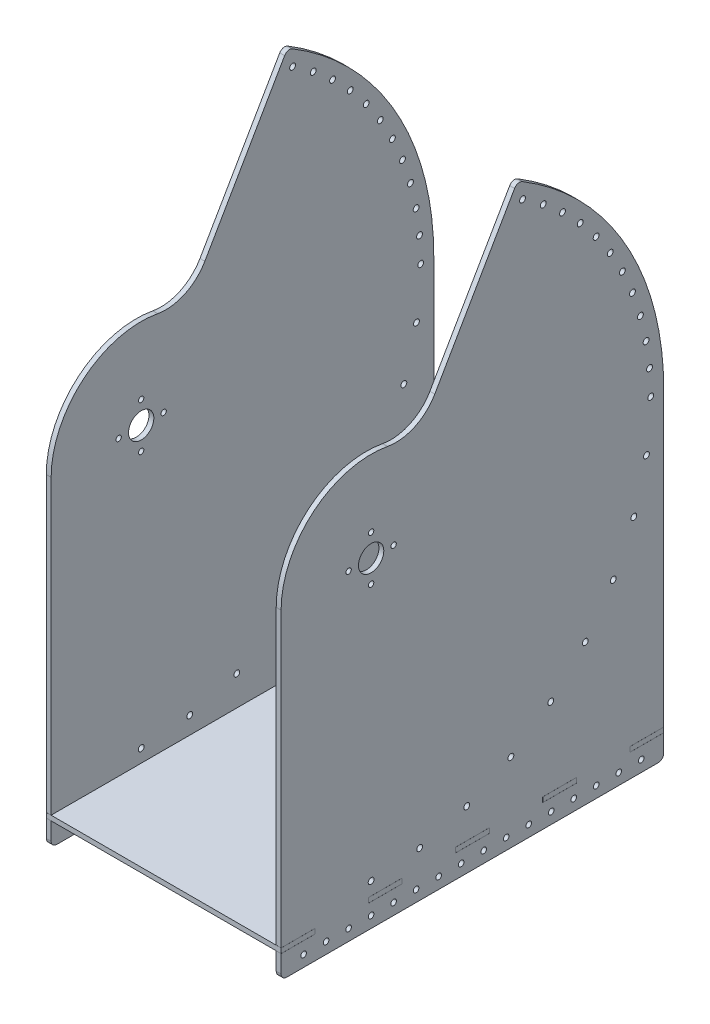
from build123d import *

# Parameters (mm, degrees)
SKETCH1_R                      = 3.302
BOSS_EXTRUDE1_DEPTH            = 2.75
CUT_EXTRUDE1_DEPTH             = 468.005706603
CUT_EXTRUDE1_DEPTH_BACK        = 468.005706603
SKETCH2_R                      = 14.2875
SKETCH2_R_2                    = 3
SKETCH3_W                      = 431.8
SKETCH3_H                      = 31.75
SKETCH3_R                      = 3.175
BOSS_EXTRUDE2_DEPTH            = 5.5
SKETCH4_W                      = 431.8
SKETCH4_H                      = 5.5
BOSS_EXTRUDE3_DEPTH            = 254
BOSS_EXTRUDE4_START            = 256.75
SKETCH1_4_R                    = 3.302
BOSS_EXTRUDE4_DEPTH            = 5.5
BOSS_EXTRUDE5_START            = 254
SKETCH3_2_W                    = 431.8
SKETCH3_2_H                    = 31.75
SKETCH3_2_R                    = 3.175
BOSS_EXTRUDE5_DEPTH            = 5.5
CUT_EXTRUDE2_DEPTH             = 301.418697827
CUT_EXTRUDE2_DEPTH_BACK        = 555.418697827
CUT_EXTRUDE2_START             = 254
SKETCH2_2_R                    = 14.2875
SKETCH2_2_R_2                  = 3
FILLET2_R                      = 6.35
FILLET3_R                      = 50.8
FILLET4_R                      = 50.8
FILLET5_R                      = 6.35
TAB_START                      = 256.75
TAB_AND_SLOT_TAB1_OUTLINE_W    = 5.5
TAB_AND_SLOT_TAB1_OUTLINE_H    = 38.1
TAB_AND_SLOT_TAB1_DEPTH        = 5.5
TAB_START_2                    = -335.75
TAB_AND_SLOT_SLOT1_OUTLINE_W   = 5.5
TAB_AND_SLOT_SLOT1_OUTLINE_H   = 38.15
TAB_AND_SLOT_SLOT1_OUTLINE_H_2 = 38.2
TAB_AND_SLOT_SLOT1_DEPTH       = 5.6
TAB_START_3                    = -330.2
TAB_AND_SLOT_TAB2_OUTLINE_W    = 5.5
TAB_AND_SLOT_TAB2_OUTLINE_H    = 5.5
TAB_AND_SLOT_TAB2_DEPTH        = 38.1
TAB_START_4                    = -231.775
TAB_AND_SLOT_TAB2_2_OUTLINE_W  = 5.5
TAB_AND_SLOT_TAB2_2_OUTLINE_H  = 5.5
TAB_AND_SLOT_TAB2_2_DEPTH      = 38.1
TAB_START_5                    = -133.35
TAB_AND_SLOT_TAB2_3_OUTLINE_W  = 5.5
TAB_AND_SLOT_TAB2_3_OUTLINE_H  = 5.5
TAB_AND_SLOT_TAB2_3_DEPTH      = 38.1
TAB_START_6                    = -34.925
TAB_AND_SLOT_TAB2_4_OUTLINE_W  = 5.5
TAB_AND_SLOT_TAB2_4_OUTLINE_H  = 5.5
TAB_AND_SLOT_TAB2_4_DEPTH      = 38.1
TAB_START_7                    = 63.5
TAB_AND_SLOT_TAB2_5_OUTLINE_W  = 5.5
TAB_AND_SLOT_TAB2_5_OUTLINE_H  = 5.5
TAB_AND_SLOT_TAB2_5_DEPTH      = 38.1
TAB_AND_SLOT_SLOT2_OUTLINE_W   = 5.5
TAB_AND_SLOT_SLOT2_OUTLINE_H   = 38.15
TAB_AND_SLOT_SLOT2_OUTLINE_H_2 = 38.2
TAB_AND_SLOT_SLOT2_DEPTH       = 5.6


# Read off the part's stored shape, not the designer's step: Tab and Slot-Tab1, Tab and Slot-Slot1, Tab and Slot-Tab2, Tab and Slot-Slot2
with BuildPart() as part:
    # Sketch1 → Boss-Extrude1 (new, symmetric)
    with BuildSketch(Plane(origin=(0, 0, 0), x_dir=(0, 0, -1), z_dir=(1, 0, 0))):
        with BuildLine():
            Line((330.2, 0), (330.2, -330.2))
            Line((330.2, -330.2), (0, -330.2))
            Line((0, -330.2), (-101.6, -330.2))
            Line((-101.6, -330.2), (-101.6, 0))
            ThreePointArc((-101.6, 0), (-50.8, 87.988181024), (50.8, 87.988181024))
            Line((50.8, 87.988181024), (165.1, 285.96158833))
            ThreePointArc((165.1, 285.96158833), (285.96158833, 165.1), (330.2, 0))
        make_face()
        with Locations((315.468, 0)):
            Circle(SKETCH1_R, mode=Mode.SUBTRACT)
        with Locations((314.169659463, 28.59167881)):
            Circle(SKETCH1_R, mode=Mode.SUBTRACT)
        with Locations((310.285324755, 56.948013714)):
            Circle(SKETCH1_R, mode=Mode.SUBTRACT)
        with Locations((303.846968623, 84.83559797)):
            Circle(SKETCH1_R, mode=Mode.SUBTRACT)
        with Locations((294.907586481, 112.024883217)):
            Circle(SKETCH1_R, mode=Mode.SUBTRACT)
        with Locations((283.540760198, 138.292068935)):
            Circle(SKETCH1_R, mode=Mode.SUBTRACT)
        with Locations((269.840052424, 163.420944593)):
            Circle(SKETCH1_R, mode=Mode.SUBTRACT)
        with Locations((253.918236464, 187.204669319)):
            Circle(SKETCH1_R, mode=Mode.SUBTRACT)
        with Locations((235.906368013, 209.447474453)):
            Circle(SKETCH1_R, mode=Mode.SUBTRACT)
        with Locations((215.952706413, 229.966274955)):
            Circle(SKETCH1_R, mode=Mode.SUBTRACT)
        with Locations((194.221494298, 248.592176419)):
            Circle(SKETCH1_R, mode=Mode.SUBTRACT)
        with Locations((170.891605681, 265.171865272)):
            Circle(SKETCH1_R, mode=Mode.SUBTRACT)
        with Locations((310.675332227, -54.780443312)):
            Circle(SKETCH1_R, mode=Mode.SUBTRACT)
        with Locations((296.442951694, -107.896410575)):
            Circle(SKETCH1_R, mode=Mode.SUBTRACT)
        with Locations((273.203302081, -157.734)):
            Circle(SKETCH1_R, mode=Mode.SUBTRACT)
        with Locations((241.662508382, -202.778921653)):
            Circle(SKETCH1_R, mode=Mode.SUBTRACT)
        with Locations((202.778921653, -241.662508382)):
            Circle(SKETCH1_R, mode=Mode.SUBTRACT)
        with Locations((157.734, -273.203302081)):
            Circle(SKETCH1_R, mode=Mode.SUBTRACT)
        with Locations((107.896410575, -296.442951694)):
            Circle(SKETCH1_R, mode=Mode.SUBTRACT)
        with Locations((54.780443312, -310.675332227)):
            Circle(SKETCH1_R, mode=Mode.SUBTRACT)
        with Locations((0, -315.468)):
            Circle(SKETCH1_R, mode=Mode.SUBTRACT)
    extrude(amount=BOSS_EXTRUDE1_DEPTH, both=True)

    # Sketch2 → Cut-Extrude1 (cut, two sides: drawn at the far end of the back side and taken through both)
    with BuildSketch(Plane(origin=(2.75, 0, 0), x_dir=(0, 0, -1), z_dir=(1, 0, 0)).offset(-CUT_EXTRUDE1_DEPTH_BACK)):
        Circle(SKETCH2_R)
        with Locations((0, 25.4)):
            Circle(SKETCH2_R_2)
        with Locations((25.4, 0)):
            Circle(SKETCH2_R_2)
        with Locations((0, -25.4)):
            Circle(SKETCH2_R_2)
        with Locations((-25.4, 0)):
            Circle(SKETCH2_R_2)
    extrude(amount=CUT_EXTRUDE1_DEPTH + CUT_EXTRUDE1_DEPTH_BACK, mode=Mode.SUBTRACT)

    # Sketch3 → Boss-Extrude2 (add)
    with BuildSketch(Plane(origin=(2.75, 0, 0), x_dir=(0, 0, -1), z_dir=(1, 0, 0))):
        with Locations((114.3, -346.075)):
            Rectangle(SKETCH3_W, SKETCH3_H)
        with Locations((-76.2, -349.25)):
            Circle(SKETCH3_R, mode=Mode.SUBTRACT)
        with Locations((-50.8, -349.25)):
            Circle(SKETCH3_R, mode=Mode.SUBTRACT)
        with Locations((-25.4, -349.25)):
            Circle(SKETCH3_R, mode=Mode.SUBTRACT)
        with Locations((0, -349.25)):
            Circle(SKETCH3_R, mode=Mode.SUBTRACT)
        with Locations((25.4, -349.25)):
            Circle(SKETCH3_R, mode=Mode.SUBTRACT)
        with Locations((50.8, -349.25)):
            Circle(SKETCH3_R, mode=Mode.SUBTRACT)
        with Locations((76.2, -349.25)):
            Circle(SKETCH3_R, mode=Mode.SUBTRACT)
        with Locations((101.6, -349.25)):
            Circle(SKETCH3_R, mode=Mode.SUBTRACT)
        with Locations((127, -349.25)):
            Circle(SKETCH3_R, mode=Mode.SUBTRACT)
        with Locations((152.4, -349.25)):
            Circle(SKETCH3_R, mode=Mode.SUBTRACT)
        with Locations((177.8, -349.25)):
            Circle(SKETCH3_R, mode=Mode.SUBTRACT)
        with Locations((203.2, -349.25)):
            Circle(SKETCH3_R, mode=Mode.SUBTRACT)
        with Locations((228.6, -349.25)):
            Circle(SKETCH3_R, mode=Mode.SUBTRACT)
        with Locations((254, -349.25)):
            Circle(SKETCH3_R, mode=Mode.SUBTRACT)
        with Locations((279.4, -349.25)):
            Circle(SKETCH3_R, mode=Mode.SUBTRACT)
        with Locations((304.8, -349.25)):
            Circle(SKETCH3_R, mode=Mode.SUBTRACT)
    extrude(amount=-BOSS_EXTRUDE2_DEPTH)

    # Fillet4
    fillet4_edges = [part.edges().sort_by_distance(p)[0] for p in [
        (0, 87.988181024, -50.8),
    ]]
    fillet(fillet4_edges, radius=FILLET4_R)

    # Fillet5
    fillet5_edges = [part.edges().sort_by_distance(p)[0] for p in [
        (0, -361.95, -330.2),
        (0, -361.95, 101.6),
        (0, 285.96158833, -165.1),
    ]]
    fillet(fillet5_edges, radius=FILLET5_R)

    # Tab and Slot-Slot2 outline → Tab and Slot-Slot2 (cut)
    with BuildSketch(Plane(origin=(0, 0, 0), x_dir=(1, 0, 0), z_dir=(0, 1, 0)).offset(TAB_START_2)):
        with Locations((0, -82.525)):
            Rectangle(TAB_AND_SLOT_SLOT2_OUTLINE_W, TAB_AND_SLOT_SLOT2_OUTLINE_H)
        with Locations((0, 15.875)):
            Rectangle(TAB_AND_SLOT_SLOT2_OUTLINE_W, TAB_AND_SLOT_SLOT2_OUTLINE_H_2)
        with Locations((0, 114.3)):
            Rectangle(TAB_AND_SLOT_SLOT2_OUTLINE_W, TAB_AND_SLOT_SLOT2_OUTLINE_H_2)
        with Locations((0, 212.725)):
            Rectangle(TAB_AND_SLOT_SLOT2_OUTLINE_W, TAB_AND_SLOT_SLOT2_OUTLINE_H_2)
        with Locations((0, 311.125)):
            Rectangle(TAB_AND_SLOT_SLOT2_OUTLINE_W, TAB_AND_SLOT_SLOT2_OUTLINE_H)
    extrude(amount=TAB_AND_SLOT_SLOT2_DEPTH, mode=Mode.SUBTRACT)


with BuildPart() as body_2:
    # Sketch4 → Boss-Extrude3 (new body)
    with BuildSketch(Plane(origin=(2.75, 0, 0), x_dir=(0, 0, -1), z_dir=(1, 0, 0))):
        with Locations((114.3, -332.95)):
            Rectangle(SKETCH4_W, SKETCH4_H)
    extrude(amount=BOSS_EXTRUDE3_DEPTH)

    # Tab and Slot-Tab1 outline → Tab and Slot-Tab1 (add)
    with BuildSketch(Plane.YZ.offset(TAB_START)):
        with Locations((-332.95, 82.55)):
            Rectangle(TAB_AND_SLOT_TAB1_OUTLINE_W, TAB_AND_SLOT_TAB1_OUTLINE_H)
        with Locations((-332.95, -15.875)):
            Rectangle(TAB_AND_SLOT_TAB1_OUTLINE_W, TAB_AND_SLOT_TAB1_OUTLINE_H)
        with Locations((-332.95, -114.3)):
            Rectangle(TAB_AND_SLOT_TAB1_OUTLINE_W, TAB_AND_SLOT_TAB1_OUTLINE_H)
        with Locations((-332.95, -212.725)):
            Rectangle(TAB_AND_SLOT_TAB1_OUTLINE_W, TAB_AND_SLOT_TAB1_OUTLINE_H)
        with Locations((-332.95, -311.15)):
            Rectangle(TAB_AND_SLOT_TAB1_OUTLINE_W, TAB_AND_SLOT_TAB1_OUTLINE_H)
    extrude(amount=TAB_AND_SLOT_TAB1_DEPTH)

    # Tab and Slot-Tab2 outline → Tab and Slot-Tab2 (add)
    with BuildSketch(Plane.XY.offset(TAB_START_3)):
        with Locations((0, -332.95)):
            Rectangle(TAB_AND_SLOT_TAB2_OUTLINE_W, TAB_AND_SLOT_TAB2_OUTLINE_H)
    extrude(amount=TAB_AND_SLOT_TAB2_DEPTH)

    # Tab and Slot-Tab2 2 outline → Tab and Slot-Tab2 2 (add)
    with BuildSketch(Plane.XY.offset(TAB_START_4)):
        with Locations((0, -332.95)):
            Rectangle(TAB_AND_SLOT_TAB2_2_OUTLINE_W, TAB_AND_SLOT_TAB2_2_OUTLINE_H)
    extrude(amount=TAB_AND_SLOT_TAB2_2_DEPTH)

    # Tab and Slot-Tab2 3 outline → Tab and Slot-Tab2 3 (add)
    with BuildSketch(Plane.XY.offset(TAB_START_5)):
        with Locations((0, -332.95)):
            Rectangle(TAB_AND_SLOT_TAB2_3_OUTLINE_W, TAB_AND_SLOT_TAB2_3_OUTLINE_H)
    extrude(amount=TAB_AND_SLOT_TAB2_3_DEPTH)

    # Tab and Slot-Tab2 4 outline → Tab and Slot-Tab2 4 (add)
    with BuildSketch(Plane.XY.offset(TAB_START_6)):
        with Locations((0, -332.95)):
            Rectangle(TAB_AND_SLOT_TAB2_4_OUTLINE_W, TAB_AND_SLOT_TAB2_4_OUTLINE_H)
    extrude(amount=TAB_AND_SLOT_TAB2_4_DEPTH)

    # Tab and Slot-Tab2 5 outline → Tab and Slot-Tab2 5 (add)
    with BuildSketch(Plane.XY.offset(TAB_START_7)):
        with Locations((0, -332.95)):
            Rectangle(TAB_AND_SLOT_TAB2_5_OUTLINE_W, TAB_AND_SLOT_TAB2_5_OUTLINE_H)
    extrude(amount=TAB_AND_SLOT_TAB2_5_DEPTH)


with BuildPart() as body_3:
    # Sketch1<4> → Boss-Extrude4 (new body)
    with BuildSketch(Plane(origin=(0, 0, 0), x_dir=(0, 0, -1), z_dir=(1, 0, 0)).offset(BOSS_EXTRUDE4_START)):
        with BuildLine():
            Line((330.2, 0), (330.2, -330.2))
            Line((330.2, -330.2), (0, -330.2))
            Line((0, -330.2), (-101.6, -330.2))
            Line((-101.6, -330.2), (-101.6, 0))
            ThreePointArc((-101.6, 0), (-50.8, 87.988181024), (50.8, 87.988181024))
            Line((50.8, 87.988181024), (165.1, 285.96158833))
            ThreePointArc((165.1, 285.96158833), (285.96158833, 165.1), (330.2, 0))
        make_face()
        with Locations((315.468, 0)):
            Circle(SKETCH1_4_R, mode=Mode.SUBTRACT)
        with Locations((314.169659463, 28.59167881)):
            Circle(SKETCH1_4_R, mode=Mode.SUBTRACT)
        with Locations((310.285324755, 56.948013714)):
            Circle(SKETCH1_4_R, mode=Mode.SUBTRACT)
        with Locations((303.846968623, 84.83559797)):
            Circle(SKETCH1_4_R, mode=Mode.SUBTRACT)
        with Locations((294.907586481, 112.024883217)):
            Circle(SKETCH1_4_R, mode=Mode.SUBTRACT)
        with Locations((283.540760198, 138.292068935)):
            Circle(SKETCH1_4_R, mode=Mode.SUBTRACT)
        with Locations((269.840052424, 163.420944593)):
            Circle(SKETCH1_4_R, mode=Mode.SUBTRACT)
        with Locations((253.918236464, 187.204669319)):
            Circle(SKETCH1_4_R, mode=Mode.SUBTRACT)
        with Locations((235.906368013, 209.447474453)):
            Circle(SKETCH1_4_R, mode=Mode.SUBTRACT)
        with Locations((215.952706413, 229.966274955)):
            Circle(SKETCH1_4_R, mode=Mode.SUBTRACT)
        with Locations((194.221494298, 248.592176419)):
            Circle(SKETCH1_4_R, mode=Mode.SUBTRACT)
        with Locations((170.891605681, 265.171865272)):
            Circle(SKETCH1_4_R, mode=Mode.SUBTRACT)
        with Locations((310.675332227, -54.780443312)):
            Circle(SKETCH1_4_R, mode=Mode.SUBTRACT)
        with Locations((296.442951694, -107.896410575)):
            Circle(SKETCH1_4_R, mode=Mode.SUBTRACT)
        with Locations((273.203302081, -157.734)):
            Circle(SKETCH1_4_R, mode=Mode.SUBTRACT)
        with Locations((241.662508382, -202.778921653)):
            Circle(SKETCH1_4_R, mode=Mode.SUBTRACT)
        with Locations((202.778921653, -241.662508382)):
            Circle(SKETCH1_4_R, mode=Mode.SUBTRACT)
        with Locations((157.734, -273.203302081)):
            Circle(SKETCH1_4_R, mode=Mode.SUBTRACT)
        with Locations((107.896410575, -296.442951694)):
            Circle(SKETCH1_4_R, mode=Mode.SUBTRACT)
        with Locations((54.780443312, -310.675332227)):
            Circle(SKETCH1_4_R, mode=Mode.SUBTRACT)
        with Locations((0, -315.468)):
            Circle(SKETCH1_4_R, mode=Mode.SUBTRACT)
    extrude(amount=BOSS_EXTRUDE4_DEPTH)


with BuildPart() as body_4:
    # Sketch3<2> → Boss-Extrude5 (new body)
    with BuildSketch(Plane(origin=(2.75, 0, 0), x_dir=(0, 0, -1), z_dir=(1, 0, 0)).offset(BOSS_EXTRUDE5_START)):
        with Locations((114.3, -346.075)):
            Rectangle(SKETCH3_2_W, SKETCH3_2_H)
        with Locations((-76.2, -349.25)):
            Circle(SKETCH3_2_R, mode=Mode.SUBTRACT)
        with Locations((-50.8, -349.25)):
            Circle(SKETCH3_2_R, mode=Mode.SUBTRACT)
        with Locations((-25.4, -349.25)):
            Circle(SKETCH3_2_R, mode=Mode.SUBTRACT)
        with Locations((0, -349.25)):
            Circle(SKETCH3_2_R, mode=Mode.SUBTRACT)
        with Locations((25.4, -349.25)):
            Circle(SKETCH3_2_R, mode=Mode.SUBTRACT)
        with Locations((50.8, -349.25)):
            Circle(SKETCH3_2_R, mode=Mode.SUBTRACT)
        with Locations((76.2, -349.25)):
            Circle(SKETCH3_2_R, mode=Mode.SUBTRACT)
        with Locations((101.6, -349.25)):
            Circle(SKETCH3_2_R, mode=Mode.SUBTRACT)
        with Locations((127, -349.25)):
            Circle(SKETCH3_2_R, mode=Mode.SUBTRACT)
        with Locations((152.4, -349.25)):
            Circle(SKETCH3_2_R, mode=Mode.SUBTRACT)
        with Locations((177.8, -349.25)):
            Circle(SKETCH3_2_R, mode=Mode.SUBTRACT)
        with Locations((203.2, -349.25)):
            Circle(SKETCH3_2_R, mode=Mode.SUBTRACT)
        with Locations((228.6, -349.25)):
            Circle(SKETCH3_2_R, mode=Mode.SUBTRACT)
        with Locations((254, -349.25)):
            Circle(SKETCH3_2_R, mode=Mode.SUBTRACT)
        with Locations((279.4, -349.25)):
            Circle(SKETCH3_2_R, mode=Mode.SUBTRACT)
        with Locations((304.8, -349.25)):
            Circle(SKETCH3_2_R, mode=Mode.SUBTRACT)
    extrude(amount=BOSS_EXTRUDE5_DEPTH)


with BuildPart() as body_3_1:
    add(body_3.part)

    # Combine1: union body 4
    add(body_4.part)

    # Sketch2<2> → Cut-Extrude2 (cut, two sides: drawn at the far end of the back side and taken through both)
    with BuildSketch(Plane(origin=(2.75, 0, 0), x_dir=(0, 0, -1), z_dir=(1, 0, 0)).offset(CUT_EXTRUDE2_START - CUT_EXTRUDE2_DEPTH_BACK)):
        Circle(SKETCH2_2_R)
        with Locations((0, 25.4)):
            Circle(SKETCH2_2_R_2)
        with Locations((25.4, 0)):
            Circle(SKETCH2_2_R_2)
        with Locations((0, -25.4)):
            Circle(SKETCH2_2_R_2)
        with Locations((-25.4, 0)):
            Circle(SKETCH2_2_R_2)
    extrude(amount=CUT_EXTRUDE2_DEPTH + CUT_EXTRUDE2_DEPTH_BACK, mode=Mode.SUBTRACT)

    # Fillet2
    fillet2_edges = [body_3_1.edges().sort_by_distance(p)[0] for p in [
        (259.5, -361.95, 101.6),
        (259.5, -361.95, -330.2),
        (259.5, 285.96158833, -165.1),
    ]]
    fillet(fillet2_edges, radius=FILLET2_R)

    # Fillet3
    fillet3_edges = [body_3_1.edges().sort_by_distance(p)[0] for p in [
        (259.5, 87.988181024, -50.8),
    ]]
    fillet(fillet3_edges, radius=FILLET3_R)

    # Tab and Slot-Slot1 outline → Tab and Slot-Slot1 (cut)
    with BuildSketch(Plane(origin=(0, 0, 0), x_dir=(1, 0, 0), z_dir=(0, 1, 0)).offset(TAB_START_2)):
        with Locations((259.5, -82.525)):
            Rectangle(TAB_AND_SLOT_SLOT1_OUTLINE_W, TAB_AND_SLOT_SLOT1_OUTLINE_H)
        with Locations((259.5, 15.875)):
            Rectangle(TAB_AND_SLOT_SLOT1_OUTLINE_W, TAB_AND_SLOT_SLOT1_OUTLINE_H_2)
        with Locations((259.5, 114.3)):
            Rectangle(TAB_AND_SLOT_SLOT1_OUTLINE_W, TAB_AND_SLOT_SLOT1_OUTLINE_H_2)
        with Locations((259.5, 212.725)):
            Rectangle(TAB_AND_SLOT_SLOT1_OUTLINE_W, TAB_AND_SLOT_SLOT1_OUTLINE_H_2)
        with Locations((259.5, 311.125)):
            Rectangle(TAB_AND_SLOT_SLOT1_OUTLINE_W, TAB_AND_SLOT_SLOT1_OUTLINE_H)
    extrude(amount=TAB_AND_SLOT_SLOT1_DEPTH, mode=Mode.SUBTRACT)


solid = Compound([part.part, body_2.part, body_3_1.part])
